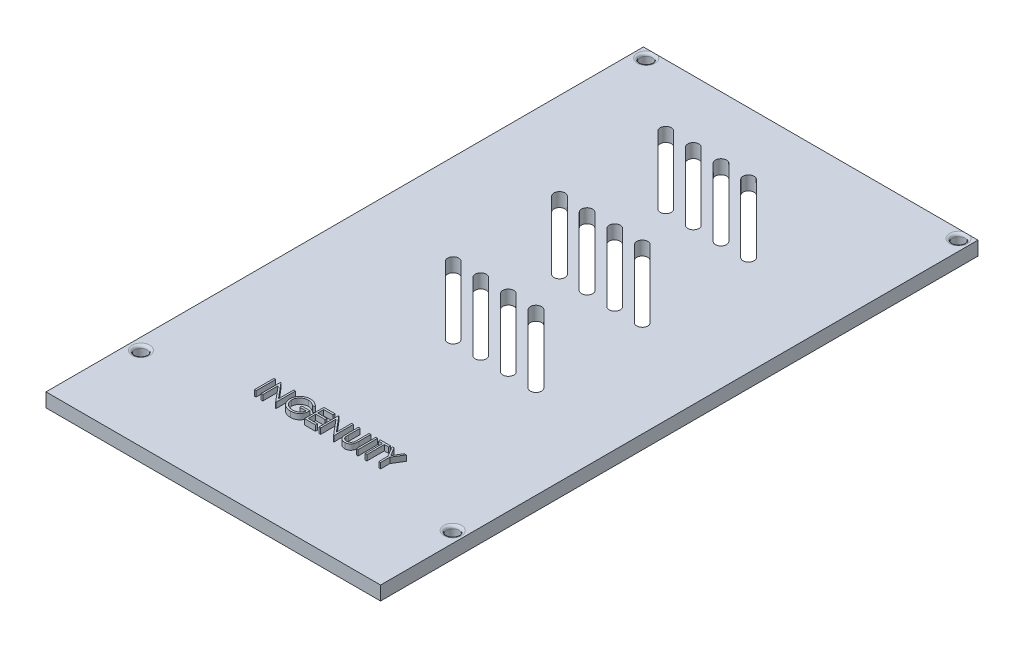
from build123d import *

# Parameters (mm, degrees)
SKETCH2_R           = 1.1000000000000036
BOSS_EXTRUDE2_DEPTH = 2.5
F_3DSKETCH2_R       = 1.0999999999999883
F_3DSKETCH2_R_2     = 1.0999999999999917
CUT_EXTRUDE4_DEPTH  = 110.26754502709187
FILLET1_R           = 0.5
FILLET2_R           = 0.5
CUT_EXTRUDE5_DEPTH  = 62.6548661280682
SKETCH4_W           = 0.3141025641025639
SKETCH4_H           = 3.500000000000007
BOSS_EXTRUDE3_DEPTH = 1


with BuildPart() as part:
    # Sketch2 → Boss-Extrude2 (new body)
    with BuildSketch(Plane(origin=(0, 0, 0), x_dir=(1, 0, 0), z_dir=(0, 1, 0))):
        Polygon((-30.10000000000001, 53.75000000000001), (30.099999999999994, 53.75000000000001), (30.10000000000001, -53.74999999999999), (-30.099999999999994, -53.74999999999999), align=None)
        with Locations(Location((-28.10000000000001, 52.25000000000001, 0), (0, 0, 270))):
            Circle(SKETCH2_R, mode=Mode.SUBTRACT)
        with Locations(Location((28.099999999999994, 52.25000000000003, 0), (0, 0, 90))):
            Circle(SKETCH2_R, mode=Mode.SUBTRACT)
    extrude(amount=BOSS_EXTRUDE2_DEPTH)

    # 3DSketch2 → Cut-Extrude4 (cut, through all)
    with BuildSketch(Plane(origin=(-28.041399267096345, 2.499999999999901, 38.73093904968545), x_dir=(0.9999997566037458, 0, 0.0006977051306255267), z_dir=(-9e-17, -1, 0))):
        with Locations(Location((0, 0, 0), (0, 0, 89.960024437))):
            Circle(F_3DSKETCH2_R)
        with Locations(Location((56.14053693984578, 0, 0), (0, 0, 89.960024437))):
            Circle(F_3DSKETCH2_R_2)
    extrude(amount=CUT_EXTRUDE4_DEPTH, mode=Mode.SUBTRACT)

    # Fillet1
    # the kernel refuses this fillet: 0.5 mm, written as the material it takes off along each edge
    with BuildSketch(Plane(origin=(-28.041399267096345, 0, 38.73093904968545), x_dir=(7.457468985773138e-12, 0, 1.0), z_dir=(-1.0, 0, 7.457468985773138e-12))) as fillet1_piece_1:
        with BuildLine():
            CenterArc((1.0999999999999872 + FILLET1_R, FILLET1_R), FILLET1_R, 180, 90)
            Line((1.0999999999999872, FILLET1_R), (1.0999999999999872, 0))
            Line((1.0999999999999872, 0), (1.0999999999999872 + FILLET1_R, 0))
        make_face()
    revolve(axis=Axis((-28.041399267096345, 0, 38.73093904968545), (9e-17, 1, 0)), mode=Mode.SUBTRACT)
    with BuildSketch(Plane(origin=(28.099124008353037, 2.4999999999998956, 38.770108590344456), x_dir=(7.45423924606509e-12, 0, 1.0), z_dir=(1.0, 0, -7.45423924606509e-12))) as fillet1_piece_2:
        with BuildLine():
            CenterArc((1.0999999999999943 + FILLET1_R, FILLET1_R), FILLET1_R, 179.99999999998803, 90.00000000001194)
            Line((1.0999999999999943, FILLET1_R), (1.0999999999999943, 0))
            Line((1.0999999999999943, 0), (1.0999999999999943 + FILLET1_R, -1.0436e-13))
        make_face()
    revolve(axis=Axis((28.099124008353037, 2.4999999999998956, 38.770108590344456), (-9e-17, -1, 0)), mode=Mode.SUBTRACT)
    with BuildSketch(Plane(origin=(28.099999999999994, 2.5, -52.25000000000003), x_dir=(0, 0, -1), z_dir=(1, 0, 0))) as fillet1_piece_3:
        with BuildLine():
            CenterArc((1.1000000000000014 + FILLET1_R, -FILLET1_R), FILLET1_R, 90, 90)
            Line((1.1000000000000014, -FILLET1_R), (1.1000000000000014, 0))
            Line((1.1000000000000014, 0), (1.1000000000000014 + FILLET1_R, 0))
        make_face()
    revolve(axis=Axis((28.099999999999994, 2.5, -52.25000000000003), (0, 1, 0)), mode=Mode.SUBTRACT)
    with BuildSketch(Plane(origin=(-28.10000000000001, 2.5, -52.25000000000001), x_dir=(0, 0, 1), z_dir=(-1, 0, 0))) as fillet1_piece_4:
        with BuildLine():
            CenterArc((1.1000000000000014 + FILLET1_R, -FILLET1_R), FILLET1_R, 90, 90)
            Line((1.1000000000000014, -FILLET1_R), (1.1000000000000014, 0))
            Line((1.1000000000000014, 0), (1.1000000000000014 + FILLET1_R, 0))
        make_face()
    revolve(axis=Axis((-28.10000000000001, 2.5, -52.25000000000001), (0, 1, 0)), mode=Mode.SUBTRACT)

    # Fillet2
    fillet2_edges = [part.edges().sort_by_distance(p)[0] for p in [
        (-28.04139926710455, 2.499999999999901, 37.630939049685466),
    ]]
    fillet(fillet2_edges, radius=FILLET2_R)

    # Sketch3 → Cut-Extrude5 (cut, through all)
    with BuildSketch(Plane(origin=(0, 2.5, 0), x_dir=(1, 0, 0), z_dir=(0, 1, 0))):
        with BuildLine():
            Line((0.7071067811865392, 43.27474438873297), (12.890514403590881, 31.091336766328915))
            ThreePointArc((12.890514403590881, 31.091336766328915), (12.890514403590899, 29.67712320395582), (11.476300841217805, 29.677123203955805))
            Line((11.476300841217805, 29.677123203955805), (-0.7071067811865376, 41.86053082635985))
            ThreePointArc((-0.7071067811865376, 41.86053082635985), (-0.7071067811865595, 43.27474438873295), (0.7071067811865392, 43.27474438873297))
        make_face()
        with BuildLine():
            Line((-4.29277431699068, 43.30922632734107), (7.890633305413664, 31.125818704937014))
            ThreePointArc((7.890633305413664, 31.125818704937014), (7.8906333054136795, 29.71160514256392), (6.476419743040587, 29.711605142563904))
            Line((6.476419743040587, 29.711605142563904), (-5.706987879363756, 41.89501276496795))
            ThreePointArc((-5.706987879363756, 41.89501276496795), (-5.706987879363778, 43.30922632734105), (-4.29277431699068, 43.30922632734107))
        make_face()
        with BuildLine():
            Line((-9.292655415167896, 43.34370826594917), (2.890752207236445, 31.160300643545117))
            ThreePointArc((2.890752207236445, 31.160300643545117), (2.8907522072364626, 29.746087081172025), (1.4765386448633688, 29.746087081172007))
            Line((1.4765386448633688, 29.746087081172007), (-10.706868977540974, 41.92949470357605))
            ThreePointArc((-10.706868977540974, 41.92949470357605), (-10.706868977540996, 43.34370826594915), (-9.292655415167896, 43.34370826594917))
        make_face()
        with BuildLine():
            Line((-14.292536513345116, 43.37819020455727), (-2.109128890940774, 31.19478258215322))
            ThreePointArc((-2.109128890940774, 31.19478258215322), (-2.1091288909407555, 29.780569019780124), (-3.5233424533138504, 29.780569019780106))
            Line((-3.5233424533138504, 29.780569019780106), (-15.706750075718194, 41.96397664218415))
            ThreePointArc((-15.706750075718194, 41.96397664218415), (-15.706750075718217, 43.37819020455725), (-14.292536513345116, 43.37819020455727))
        make_face()
        with BuildLine():
            Line((-3.701170568804192, 23.58910138779921), (8.48223705360015, 11.405693765395158))
            ThreePointArc((8.48223705360015, 11.405693765395158), (8.482237053600167, 9.991480203022066), (7.068023491227074, 9.991480203022048))
            Line((7.068023491227074, 9.991480203022048), (-5.115384131177269, 22.174887825426094))
            ThreePointArc((-5.115384131177269, 22.174887825426094), (-5.11538413117729, 23.58910138779919), (-3.701170568804192, 23.58910138779921))
        make_face()
        with BuildLine():
            Line((-8.701051666981408, 23.623583326407314), (3.482355955422933, 11.440175704003263))
            ThreePointArc((3.482355955422933, 11.440175704003263), (3.48235595542295, 10.025962141630169), (2.0681423930498566, 10.025962141630151))
            Line((2.0681423930498566, 10.025962141630151), (-10.115265229354486, 22.209369764034196))
            ThreePointArc((-10.115265229354486, 22.209369764034196), (-10.115265229354504, 23.623583326407296), (-8.701051666981408, 23.623583326407314))
        make_face()
        with BuildLine():
            Line((-13.700932765158628, 23.658065265015416), (-1.5175251427542862, 11.474657642611362))
            ThreePointArc((-1.5175251427542862, 11.474657642611362), (-1.5175251427542693, 10.06044408023827), (-2.9317387051273625, 10.060444080238252))
            Line((-2.9317387051273625, 10.060444080238252), (-15.115146327531706, 22.243851702642296))
            ThreePointArc((-15.115146327531706, 22.243851702642296), (-15.115146327531729, 23.658065265015395), (-13.700932765158628, 23.658065265015416))
        make_face()
        with BuildLine():
            Line((-3.1095668206177045, 3.868976448257358), (9.073840801786638, -8.314431174146694))
            ThreePointArc((9.073840801786638, -8.314431174146694), (9.073840801786654, -9.728644736519787), (7.659627239413561, -9.728644736519804))
            Line((7.659627239413561, -9.728644736519804), (-4.523780382990782, 2.4547628858842403))
            ThreePointArc((-4.523780382990782, 2.4547628858842403), (-4.523780382990802, 3.868976448257338), (-3.1095668206177045, 3.868976448257358))
        make_face()
        with BuildLine():
            Line((-8.109447918794922, 3.903458386865455), (4.073959703609419, -8.279949235538597))
            ThreePointArc((4.073959703609419, -8.279949235538597), (4.073959703609438, -9.69416279791169), (2.6597461412363432, -9.694162797911709))
            Line((2.6597461412363432, -9.694162797911709), (-9.523661481168, 2.489244824492337))
            ThreePointArc((-9.523661481168, 2.489244824492337), (-9.523661481168023, 3.903458386865436), (-8.109447918794922, 3.903458386865455))
        make_face()
        with BuildLine():
            Line((-13.109329016972142, 3.9379403254735585), (-0.9259213945678, -8.245467296930494))
            ThreePointArc((-0.9259213945678, -8.245467296930494), (-0.925921394567783, -9.659680859303588), (-2.3401349569408763, -9.659680859303604))
            Line((-2.3401349569408763, -9.659680859303604), (-14.52354257934522, 2.523726763100441))
            ThreePointArc((-14.52354257934522, 2.523726763100441), (-14.52354257934524, 3.937940325473539), (-13.109329016972142, 3.9379403254735585))
        make_face()
        with BuildLine():
            Line((1.2987105293730266, 23.55461944919111), (13.48211815177737, 11.371211826787057))
            ThreePointArc((13.48211815177737, 11.371211826787057), (13.482118151777387, 9.956998264413963), (12.067904589404293, 9.956998264413947))
            Line((12.067904589404293, 9.956998264413947), (-0.11550303300005027, 22.14040588681799))
            ThreePointArc((-0.11550303300005027, 22.14040588681799), (-0.11550303300007225, 23.55461944919109), (1.2987105293730266, 23.55461944919111))
        make_face()
        with BuildLine():
            Line((1.8903142775595136, 3.834494509649254), (14.073721899963855, -8.348913112754799))
            ThreePointArc((14.073721899963855, -8.348913112754799), (14.073721899963873, -9.763126675127893), (12.659508337590779, -9.763126675127909))
            Line((12.659508337590779, -9.763126675127909), (0.476100715186437, 2.420280947276136))
            ThreePointArc((0.476100715186437, 2.420280947276136), (0.4761007151864166, 3.8344945096492333), (1.8903142775595136, 3.834494509649254))
        make_face()
    extrude(amount=-CUT_EXTRUDE5_DEPTH, mode=Mode.SUBTRACT)

    # Sketch4 → Boss-Extrude3 (add)
    with BuildSketch(Plane(origin=(0, 2.5, 0), x_dir=(1, 0, 0), z_dir=(0, 1, 0))):
        with Locations((-10.537591399478504, -33.908754016792784)):
            Rectangle(SKETCH4_W, SKETCH4_H)
        Polygon((-9.483104219991322, -35.658754016792784), (-9.483104219991322, -32.15875401679278), (-9.417198771273375, -32.15875401679278), (-7.104899091786195, -34.91346154884407), (-7.104899091786195, -32.15875401679278), (-6.790796527683631, -32.15875401679278), (-6.790796527683631, -35.658754016792784), (-6.862310950760555, -35.658754016792784), (-9.16900165588876, -32.910356580895346), (-9.16900165588876, -35.658754016792784), align=None)
        with BuildLine():
            Line((-2.6177196046067075, -32.75610978602355), (-2.8869503738374775, -33.011318119356886))
            add(Edge.make_bspline(
                [(-2.8869503738374775, -33.011318119356886), (-2.9356692619583695, -32.96548725634786), (-3.0319453084929253, -32.8749183934291), (-3.188905551120028, -32.75740739829278), (-3.352669185113943, -32.6567412981306), (-3.522381681998255, -32.57483506169538), (-3.6938402359087137, -32.50948230118754), (-3.864769012179567, -32.462954160970526), (-4.0334147135316725, -32.4332816235118), (-4.145581931936279, -32.42973325415471), (-4.200852617427221, -32.42798478602355)],
                knots=[0, 0, 0, 0, 1.089155929620504, 2.15234031415762, 3.188132943981478, 4.21679630881789, 5.2182603572482265, 6.173443236427205, 7.099959454761374, 8, 8, 8, 8], degree=3))
            add(Edge.make_bspline(
                [(-4.200852617427221, -32.42798478602355), (-4.234767317367224, -32.42839839191803), (-4.302508757970138, -32.42922453100178), (-4.403130702019796, -32.439768746267724), (-4.502697339056105, -32.45493361029337), (-4.60102071380917, -32.476875488019296), (-4.69829200016931, -32.504684547514834), (-4.794172892376007, -32.539470010751735), (-4.888842247113003, -32.58002525501046), (-4.981408328171403, -32.626887728736136), (-5.07114883170758, -32.678367575166256), (-5.15590566735504, -32.73541611575085), (-5.236219066216869, -32.79620490559595), (-5.310579491544069, -32.862255885113925), (-5.379414678247393, -32.932970750416175), (-5.444363050142636, -33.00703405653611), (-5.503140346080708, -33.086469275116045), (-5.556231510993749, -33.16981490113014), (-5.603593129396943, -33.25560709042341), (-5.645401782933522, -33.34302008010325), (-5.680498871067217, -33.43176393451826), (-5.708268326365864, -33.521950012126545), (-5.73117898025476, -33.612880602085156), (-5.7472965874242155, -33.7051853225262), (-5.756383309605036, -33.79896300790505), (-5.757955089581728, -33.86176026630265), (-5.7587452456323485, -33.89332933730561)],
                knots=[0, 0, 0, 0, 1.0281887396954708, 2.053710826334383, 3.065248034441582, 4.081641283313714, 5.106893872881587, 6.1315582228086605, 7.1730501747693225, 8.228653731193262, 9.27666205963316, 10.30877701312975, 11.325269123323878, 12.329503258059185, 13.321960950097452, 14.316845687191476, 15.314881793397658, 16.3157330979599, 17.311955232866875, 18.28532074779725, 19.25278388550116, 20.203351036313375, 21.145449891484322, 22.095197416758612, 23.042428769481585, 24, 24, 24, 24], degree=3))
            add(Edge.make_bspline(
                [(-5.7587452456323485, -33.89332933730561), (-5.757989527365152, -33.92560015452856), (-5.7564801544459065, -33.990053668109674), (-5.746819834874522, -34.08624774070248), (-5.7288915944418495, -34.18101314311782), (-5.704923885572625, -34.274661276181384), (-5.674943069900487, -34.36735252410891), (-5.637570403818577, -34.45868503394698), (-5.593304803310245, -34.54865542517416), (-5.542068251282706, -34.63645304210262), (-5.485882047793743, -34.721976065379906), (-5.422938966805759, -34.802535587207664), (-5.356078383373021, -34.879204364447276), (-5.282864483539211, -34.95028012824278), (-5.205644941289492, -35.017664024530255), (-5.1221126652864415, -35.079499546470586), (-5.033910204816756, -35.1369777697496), (-4.940902992935787, -35.18937428910563), (-4.844100210494614, -35.2361828248081), (-4.744843457405511, -35.27780672093291), (-4.642815641796539, -35.31208605821573), (-4.538552952146672, -35.34002416222836), (-4.43217968047214, -35.36292445944821), (-4.323155877764458, -35.37765693979248), (-4.212283169379663, -35.38834777070036), (-4.137544537297644, -35.389129440765934), (-4.099891078965682, -35.38952324756201)],
                knots=[0, 0, 0, 0, 0.9358608798224424, 1.8691662349590417, 2.7996375980533053, 3.7299855482730884, 4.670839026793811, 5.622275134006224, 6.589130586016112, 7.576015414638863, 8.568469353047442, 9.553980289594364, 10.538348739546944, 11.515998671372072, 12.510579167145702, 13.508179872816376, 14.527009472310207, 15.561807828814281, 16.60145501294313, 17.64357324348079, 18.680854197502153, 19.719860599271158, 20.772568776141316, 21.833555941025207, 22.908541555676194, 24, 24, 24, 24], degree=3))
            add(Edge.make_bspline(
                [(-4.099891078965682, -35.38952324756201), (-4.05451273173149, -35.38857467124898), (-3.9654049744696, -35.38671198754633), (-3.8344185317638275, -35.37221169815797), (-3.7086154610380517, -35.349564904496205), (-3.5883492577816165, -35.31639900781044), (-3.4734802370781237, -35.274095332813296), (-3.363587295748815, -35.22309994634617), (-3.259535637098828, -35.16145688726847), (-3.1610124635462644, -35.09188302018289), (-3.0702552780617958, -35.01436818769649), (-2.9884011539721076, -34.93072373254132), (-2.9167556647522788, -34.84135566588641), (-2.85425096549432, -34.74679035058633), (-2.8025423111311984, -34.646245045576116), (-2.760099516057181, -34.540212483119596), (-2.727566224433663, -34.42864497118327), (-2.714211249592224, -34.35155333945798), (-2.7074631943502983, -34.31260017063894)],
                knots=[0, 0, 0, 0, 1.1300810802475492, 2.2190978015408613, 3.2786834373552223, 4.311054134795187, 5.322181354352848, 6.324827111997568, 7.324222903542769, 8.330512326811887, 9.325626430196245, 10.293043161616813, 11.241283710448208, 12.174520618042976, 13.111833804279627, 14.052305214773732, 15.015860968578096, 16, 16, 16, 16], degree=3))
            Line((-2.7074631943502983, -34.31260017063894), (-3.874129861016964, -34.31260017063894))
            Line((-3.874129861016964, -34.31260017063894), (-3.874129861016964, -33.95362581166458))
            Line((-3.874129861016964, -33.95362581166458), (-2.393360630247733, -33.95362581166458))
            add(Edge.make_bspline(
                [(-2.393360630247733, -33.95362581166458), (-2.395066478626683, -34.02053330048543), (-2.3984051320479147, -34.151483342244305), (-2.4218240477019157, -34.34245361307895), (-2.459640559968242, -34.52282530639092), (-2.51130087183047, -34.692788378056136), (-2.578176152132258, -34.85210197081224), (-2.659548680581834, -35.00092783695356), (-2.756720801648223, -35.13830451782043), (-2.8662312431578165, -35.265353521432836), (-2.989131200943836, -35.37868273360585), (-3.122099820921418, -35.47828867155122), (-3.2653567892739233, -35.56219128689532), (-3.4187665967634753, -35.63045194929925), (-3.581827030202532, -35.68372594421412), (-3.7549154099820403, -35.72149752089764), (-3.937797010666216, -35.74412748424502), (-4.063133687555551, -35.747018863646005), (-4.127234828965682, -35.748497606536375)],
                knots=[0, 0, 0, 0, 1.1403564462694686, 2.2318835587867993, 3.2741666994454293, 4.27849184618022, 5.255129560431746, 6.214354610264646, 7.163742900132238, 8.118265939699487, 9.068280885814957, 10.007653400262688, 10.945064094700756, 11.89197513304547, 12.864533718372124, 13.863980011194773, 14.90757180774655, 16, 16, 16, 16], degree=3))
            add(Edge.make_bspline(
                [(-4.127234828965682, -35.748497606536375), (-4.166744964329614, -35.74792848530434), (-4.2446716851776305, -35.74680599480998), (-4.3597626132508145, -35.73882864738095), (-4.471680233828503, -35.72654807108426), (-4.580408242718439, -35.70800294760687), (-4.686346584897191, -35.685288293449425), (-4.788966169820147, -35.65620157466975), (-4.888657911867941, -35.62253287532205), (-4.985575897509792, -35.584237201848694), (-5.078840444292429, -35.539865545180156), (-5.16886696126455, -35.49055590569226), (-5.256153087000134, -35.436562544944586), (-5.340104251975689, -35.37695169921947), (-5.4211578734510875, -35.31216923904936), (-5.498791317056474, -35.24208532006963), (-5.573439195123884, -35.16691420032952), (-5.62019965866506, -35.113535190730246), (-5.643761271273375, -35.0866386321774)],
                knots=[0, 0, 0, 0, 1.1077843793338518, 2.184907829168043, 3.2335065162772954, 4.263428165856921, 5.276301165964388, 6.270063454742838, 7.252329489648618, 8.225834625127384, 9.190232165847783, 10.146266621621209, 11.102772599989207, 12.066435140918193, 13.031522626080545, 14.010570082098754, 14.99756817004802, 16, 16, 16, 16], degree=3))
            add(Edge.make_bspline(
                [(-5.643761271273375, -35.0866386321774), (-5.677947203209041, -35.04396797916701), (-5.745751615845183, -34.95933496200618), (-5.83302977246447, -34.82373501757771), (-5.907431175295236, -34.68333315740822), (-5.967798997430512, -34.53773852905095), (-6.01493708377268, -34.38708731620479), (-6.048743336520115, -34.23157202497723), (-6.068550625708868, -34.07099239443954), (-6.071404163149521, -33.962327129773236), (-6.072847809734913, -33.90735177320304)],
                knots=[0, 0, 0, 0, 1.0231654189882713, 2.0293473465829415, 3.0139074576560634, 3.99475578196859, 4.975994454848629, 5.96558838010502, 6.97076122201771, 8, 8, 8, 8], degree=3))
            add(Edge.make_bspline(
                [(-6.072847809734913, -33.90735177320304), (-6.072315571598156, -33.86618552051464), (-6.071257859746252, -33.784376213063915), (-6.058432343575006, -33.66291890560668), (-6.040030925580886, -33.543618213443466), (-6.01298387099258, -33.42657165716969), (-5.978887606277083, -33.31170106540797), (-5.936334120259709, -33.19895310154038), (-5.886789224303456, -33.08826122992857), (-5.829203728139756, -32.980387361934454), (-5.765119268668276, -32.87676294915058), (-5.695569048341194, -32.777805145782644), (-5.6195654481055515, -32.68531608080065), (-5.5383496485757915, -32.598124432541844), (-5.450952658359725, -32.517325585555895), (-5.358193234692194, -32.44217147487474), (-5.259999891814136, -32.3725612890716), (-5.1560637118228545, -32.309591454327915), (-5.0479360273864, -32.253027833860614), (-4.935876025939673, -32.203438622139984), (-4.819917915032848, -32.162455306674005), (-4.700930437402844, -32.127681527045475), (-4.578012936758776, -32.101966386454116), (-4.452057399880053, -32.08331764106904), (-4.32240728786268, -32.07055704140876), (-4.234771258536307, -32.06953078559974), (-4.190335790504144, -32.0690104270492)],
                knots=[0, 0, 0, 0, 1.0089451128291644, 2.005067149568622, 2.9914333601627745, 3.9672735228469476, 4.9480979312767746, 5.927297278293452, 6.919902384572703, 7.919676787804935, 8.92313934949325, 9.905703106192375, 10.88302273244944, 11.856032218072043, 12.825136022427959, 13.798837087139331, 14.781400843838469, 15.773989409318288, 16.776158563784882, 17.771670570006464, 18.775803736981107, 19.78961893110551, 20.80898984954147, 21.85198875557336, 22.910860228171863, 24, 24, 24, 24], degree=3))
            add(Edge.make_bspline(
                [(-4.190335790504144, -32.0690104270492), (-4.154097546841268, -32.06958991879306), (-4.082241368103609, -32.070738982823634), (-3.975315635793666, -32.07870363089414), (-3.8700426211492553, -32.09132751200795), (-3.766266231271318, -32.1085542986015), (-3.6643398650451933, -32.13201798910737), (-3.5639731596213737, -32.16009627375709), (-3.4650206233739413, -32.19278809632798), (-3.367792374209103, -32.23177694266825), (-3.271634658177852, -32.27603056759397), (-3.176012817704242, -32.32584398999904), (-3.081253571726826, -32.38206899462955), (-2.9871925903003733, -32.444872530156694), (-2.8932367323844588, -32.513175948009405), (-2.8008720900305666, -32.588932771655664), (-2.707869145783683, -32.66915552750513), (-2.648067331569321, -32.726837711409516), (-2.6177196046067075, -32.75610978602355)],
                knots=[0, 0, 0, 0, 0.9858711171279622, 1.9548665731064954, 2.9154603271730934, 3.8698260585779374, 4.8153608896418785, 5.759505085974267, 6.704526690205889, 7.649098992208379, 8.607881297171524, 9.583363685267157, 10.5811372621162, 11.60396110218709, 12.659522466435986, 13.739935549517039, 14.853081302595442, 15.999999999999998, 15.999999999999998, 15.999999999999998, 15.999999999999998], degree=3))
        make_face()
        Polygon((-1.6754119122990159, -32.15875401679278), (0.2989470620599587, -32.15875401679278), (0.2989470620599587, -32.51772837576714), (-1.3613093481964507, -32.51772837576714), (-1.3613093481964507, -33.59465145269022), (0.2989470620599587, -33.59465145269022), (0.2989470620599587, -33.95362581166458), (-1.3613093481964507, -33.95362581166458), (-1.3613093481964507, -35.29977965781842), (0.2989470620599587, -35.29977965781842), (0.2989470620599587, -35.658754016792784), (-1.6754119122990159, -35.658754016792784), align=None)
        Polygon((0.9271521902650872, -35.658754016792784), (0.9271521902650872, -32.15875401679278), (0.9930576389830352, -32.15875401679278), (3.3053573184702154, -34.91346154884407), (3.3053573184702154, -32.15875401679278), (3.619459882572779, -32.15875401679278), (3.619459882572779, -35.658754016792784), (3.5479454594958564, -35.658754016792784), (1.2412547543676506, -32.910356580895346), (1.2412547543676506, -35.658754016792784), align=None)
        with BuildLine():
            Line((4.516895780008675, -32.15875401679278), (4.830998344111243, -32.15875401679278))
            Line((4.830998344111243, -32.15875401679278), (4.830998344111243, -34.25580930525432))
            add(Edge.make_bspline(
                [(4.830998344111243, -34.25580930525432), (4.830951600138501, -34.28549004099904), (4.830862895394847, -34.34181435194896), (4.83145540926623, -34.42198265247868), (4.833114777679471, -34.49325511153041), (4.834160937237755, -34.55590645909864), (4.836488270772887, -34.609649206557464), (4.83838631767286, -34.65477451724138), (4.840826874381676, -34.69106871969584), (4.84375999188139, -34.712249645746745), (4.845020780008678, -34.72135417704919)],
                knots=[0, 0, 0, 0, 1.5286287337257833, 2.900836450479861, 4.128790002228556, 5.200304208318719, 6.127813767894408, 6.898992206395199, 7.526736465769426, 8, 8, 8, 8], degree=3))
            add(Edge.make_bspline(
                [(4.845020780008678, -34.72135417704919), (4.850198238813941, -34.75420094040069), (4.860261425149484, -34.81804366953833), (4.8859078029256855, -34.90895195138347), (4.921725303926837, -34.9908834096606), (4.964168346652987, -35.06639470077254), (5.020100958003376, -35.13338406081718), (5.087104493280123, -35.19509571360909), (5.16828226181115, -35.24906751825108), (5.258542867484423, -35.2984183300721), (5.3558281049993655, -35.33808341243881), (5.455239371350555, -35.368076776779205), (5.555282350505701, -35.386355676552775), (5.622258515586417, -35.3884722155254), (5.655517574880472, -35.38952324756201)],
                knots=[0, 0, 0, 0, 1.035780044887149, 2.0131975910153463, 2.9331922126183394, 3.8176159482174388, 4.702609283759576, 5.640816604701092, 6.646850144566939, 7.73207397971786, 8.84249596001412, 9.914020371691768, 10.964143138674958, 12, 12, 12, 12], degree=3))
            add(Edge.make_bspline(
                [(5.655517574880472, -35.38952324756201), (5.684071315273096, -35.388449397280375), (5.741013877172351, -35.38630789899357), (5.825620307861186, -35.373046467964095), (5.9080204165114845, -35.349145902283425), (5.988621096418804, -35.31830614386475), (6.06417208083839, -35.27755855276959), (6.134715522849868, -35.23048771329729), (6.197679457078301, -35.1752768372795), (6.25513745491041, -35.11417649274874), (6.3051723907630075, -35.04523669278152), (6.348543532364747, -34.96995855473264), (6.384069462010256, -34.887209207850056), (6.401612986849714, -34.829054785600114), (6.410625747957393, -34.79917869627997)],
                knots=[0, 0, 0, 0, 0.9946877706824037, 1.9836304867136545, 2.973142513375077, 3.978332532717635, 4.9833577533018865, 5.956394765808665, 6.9258161762537815, 7.89339048166662, 8.871859703932204, 9.88551697999583, 10.91371144054937, 12, 12, 12, 12], degree=3))
            add(Edge.make_bspline(
                [(6.410625747957393, -34.79917869627997), (6.4136258732524265, -34.78683012193722), (6.420311361453432, -34.75931252185423), (6.426558406439456, -34.712791231299676), (6.4330649318551965, -34.65790186733279), (6.437579501856102, -34.59425005452236), (6.441980722270465, -34.52204908191802), (6.444613795066857, -34.44092282443459), (6.445830827991002, -34.35116586362346), (6.44619350834548, -34.28852870184772), (6.446382959495859, -34.25580930525432)],
                knots=[0, 0, 0, 0, 0.5586808313235303, 1.244966039293358, 2.0624124532661945, 2.990489872530982, 4.05121994139496, 5.244515665144862, 6.560634259230855, 8, 8, 8, 8], degree=3))
            Line((6.446382959495859, -34.25580930525432), (6.446382959495859, -32.15875401679278))
            Line((6.446382959495859, -32.15875401679278), (6.760485523598422, -32.15875401679278))
            Line((6.760485523598422, -32.15875401679278), (6.760485523598422, -34.272636228331244))
            add(Edge.make_bspline(
                [(6.760485523598422, -34.272636228331244), (6.760231403213921, -34.31073460727999), (6.759735471833033, -34.38508591018191), (6.755434895335895, -34.49403726920593), (6.748577895483733, -34.59739025051283), (6.738889807509629, -34.695158747040466), (6.72605280433957, -34.78699290628399), (6.71177758383491, -34.87369767445939), (6.693598050777882, -34.954650667106414), (6.672364649594692, -35.03048308475189), (6.648091101557861, -35.102668598165806), (6.616649953216985, -35.1711772128297), (6.581225453284137, -35.23809161245985), (6.539210800372378, -35.302399721341764), (6.4919994177296, -35.36438627447932), (6.438547736982342, -35.42367534948908), (6.380623576088388, -35.481214395763686), (6.317264016490782, -35.53552746191648), (6.249513491234049, -35.585336138804045), (6.177573533575903, -35.62913390988786), (6.101996763823348, -35.66615752736893), (6.022979637699094, -35.69663345177003), (5.940488434809737, -35.7195480509677), (5.85452107508567, -35.736623206748696), (5.764881881771082, -35.74632550428826), (5.703917225573047, -35.74776743434805), (5.673045619752268, -35.748497606536375)],
                knots=[0, 0, 0, 0, 1.3165928506836984, 2.569410997023413, 3.767480509836557, 4.89581465239142, 5.963796858884344, 6.971599529772558, 7.931736103156577, 8.82926221831114, 9.692595152492919, 10.560224239377893, 11.431080258712436, 12.307015069760391, 13.211635791128924, 14.121146778596263, 15.063487852076479, 16.031507146905184, 17.002386180002038, 17.966455254927236, 18.93810665269876, 19.907068911160966, 20.8889050873243, 21.89314145158664, 22.93311779836047, 24, 24, 24, 24], degree=3))
            add(Edge.make_bspline(
                [(5.673045619752268, -35.748497606536375), (5.639376517144304, -35.74771284127223), (5.573317858265222, -35.74617313463117), (5.475979790985489, -35.73735038450322), (5.3826655946863875, -35.72073199018802), (5.292389717661456, -35.69957204646501), (5.206381220526467, -35.67038830918655), (5.123487776144685, -35.63629018432641), (5.045129095025885, -35.59441292404341), (4.970033966410493, -35.54781953102359), (4.900209210254267, -35.4953948928549), (4.836111807146637, -35.43825471890418), (4.777635936555239, -35.37731434150878), (4.725767240207164, -35.311913975740424), (4.67964635562685, -35.24256226873653), (4.639916142223654, -35.16906302892739), (4.605802898103548, -35.09144471277304), (4.588196331045667, -35.03749151236787), (4.579295619752267, -35.010216356536375)],
                knots=[0, 0, 0, 0, 1.1387920599301602, 2.234305948010013, 3.3010755825914364, 4.3419718430701275, 5.366689342661038, 6.369221514445795, 7.369726634116578, 8.36751217787575, 9.355451585479335, 10.318319045061827, 11.268648973132644, 12.207971038709154, 13.137398894462034, 14.081662263627207, 15.030215811034743, 16, 16, 16, 16], degree=3))
            add(Edge.make_bspline(
                [(4.579295619752267, -35.010216356536375), (4.574118461577968, -34.991583782087126), (4.562889090201475, -34.95116931315522), (4.550863792556686, -34.88428282459776), (4.540754710915223, -34.80726790694747), (4.531249152694006, -34.72011928857944), (4.525640194737294, -34.6227694219769), (4.520722756040977, -34.51526050610745), (4.516861137244424, -34.397462544421266), (4.516883909647947, -34.315408028803674), (4.516895780008675, -34.272636228331244)],
                knots=[0, 0, 0, 0, 0.6250389212674607, 1.3557233399818398, 2.1946823268326985, 3.1368813068314028, 4.189498638860178, 5.346923369111682, 6.6170552170062376, 8, 8, 8, 8], degree=3))
            Line((4.516895780008675, -34.272636228331244), (4.516895780008675, -32.15875401679278))
        make_face()
        with Locations((7.814972703085602, -33.908754016792784)):
            Rectangle(SKETCH4_W, SKETCH4_H)
        Polygon((8.465613728726625, -32.51772837576714), (8.465613728726625, -32.15875401679278), (10.305357318470216, -32.15875401679278), (10.305357318470216, -32.51772837576714), (9.542536805649704, -32.51772837576714), (9.542536805649704, -35.658754016792784), (9.228434241547141, -35.658754016792784), (9.228434241547141, -32.51772837576714), align=None)
        Polygon((10.574588087700985, -32.15875401679278), (10.934263568470215, -32.15875401679278), (11.85413536334201, -33.662660266792784), (12.772604914624065, -32.15875401679278), (13.132280395393295, -32.15875401679278), (12.010485523598422, -33.99499199756202), (12.010485523598422, -35.658754016792784), (11.696382959495857, -35.658754016792784), (11.696382959495857, -33.99499199756202), align=None)
    extrude(amount=BOSS_EXTRUDE3_DEPTH)


solid = part.part
